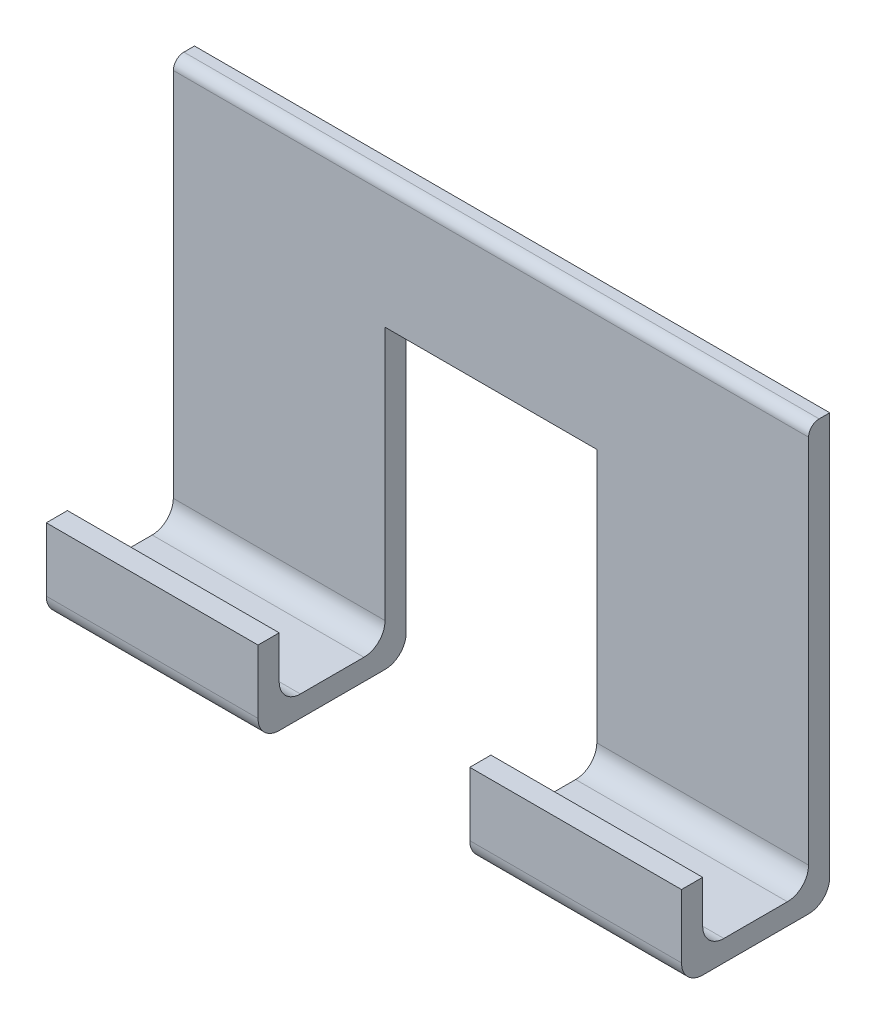
from build123d import *

# Parameters (mm, degrees)
BOSS_EXTRUDE2_DEPTH = 150
SKETCH3_W           = 100
SKETCH3_H           = 280
CUT_EXTRUDE3_DEPTH  = 260.615099715
FILLET2_START       = -151
FILLET2_DEPTH       = 302
FILLET2_START_2     = -150
FILLET2_2_DEPTH     = 100
FILLET2_START_3     = 50
FILLET2_3_DEPTH     = 100
FILLET3_R           = 5


with BuildPart() as part:
    # Sketch2 → Boss-Extrude2 (new, symmetric)
    with BuildSketch(Plane(origin=(0, 0, 0), x_dir=(0, 0, -1), z_dir=(1, 0, 0))):
        Polygon((-60, 10), (-10, 10), (-10, 200), (0, 200), (0, 0), (-26, 0), (-70, 0), (-70, 40), (-60, 40), align=None)
    extrude(amount=BOSS_EXTRUDE2_DEPTH, both=True)

    # Sketch3 → Cut-Extrude3 (cut, through all)
    with BuildSketch(Plane.XY.offset(70)):
        Rectangle(SKETCH3_W, SKETCH3_H)
    extrude(amount=-CUT_EXTRUDE3_DEPTH, mode=Mode.SUBTRACT)

    # Fillet2: read off the stored shape, not the designer's step
    # Fillet2 outline → Fillet2 (cut)
    with BuildSketch(Plane.YZ.offset(FILLET2_START)):
        with BuildLine():
            Line((0, 0), (10, 0))
            ThreePointArc((10, 0), (2.928932188, 2.928932188), (0, 10))
            Line((0, 10), (0, 0))
        make_face()
        with BuildLine():
            Line((0, 70), (0, 60))
            ThreePointArc((0, 60), (2.928932188, 67.071067812), (10, 70))
            Line((10, 70), (0, 70))
        make_face()
    extrude(amount=FILLET2_DEPTH, mode=Mode.SUBTRACT)

    # Fillet2 2 outline → Fillet2 2 (add)
    with BuildSketch(Plane.YZ.offset(FILLET2_START_2)):
        with BuildLine():
            Line((10, 60), (10, 50))
            ThreePointArc((10, 50), (12.928932188, 57.071067812), (20, 60))
            Line((20, 60), (10, 60))
        make_face()
        with BuildLine():
            ThreePointArc((20, 10), (12.928932188, 12.928932188), (10, 20))
            Line((10, 20), (10, 10))
            Line((10, 10), (20, 10))
        make_face()
    extrude(amount=FILLET2_2_DEPTH)

    # Fillet2 3 outline → Fillet2 3 (add)
    with BuildSketch(Plane.YZ.offset(FILLET2_START_3)):
        with BuildLine():
            Line((10, 60), (10, 50))
            ThreePointArc((10, 50), (12.928932188, 57.071067812), (20, 60))
            Line((20, 60), (10, 60))
        make_face()
        with BuildLine():
            ThreePointArc((20, 10), (12.928932188, 12.928932188), (10, 20))
            Line((10, 20), (10, 10))
            Line((10, 10), (20, 10))
        make_face()
    extrude(amount=FILLET2_3_DEPTH)

    # Fillet3
    fillet3_edges = [part.edges().sort_by_distance(p)[0] for p in [
        (0, 200, 10),
    ]]
    fillet(fillet3_edges, radius=FILLET3_R)


solid = part.part
